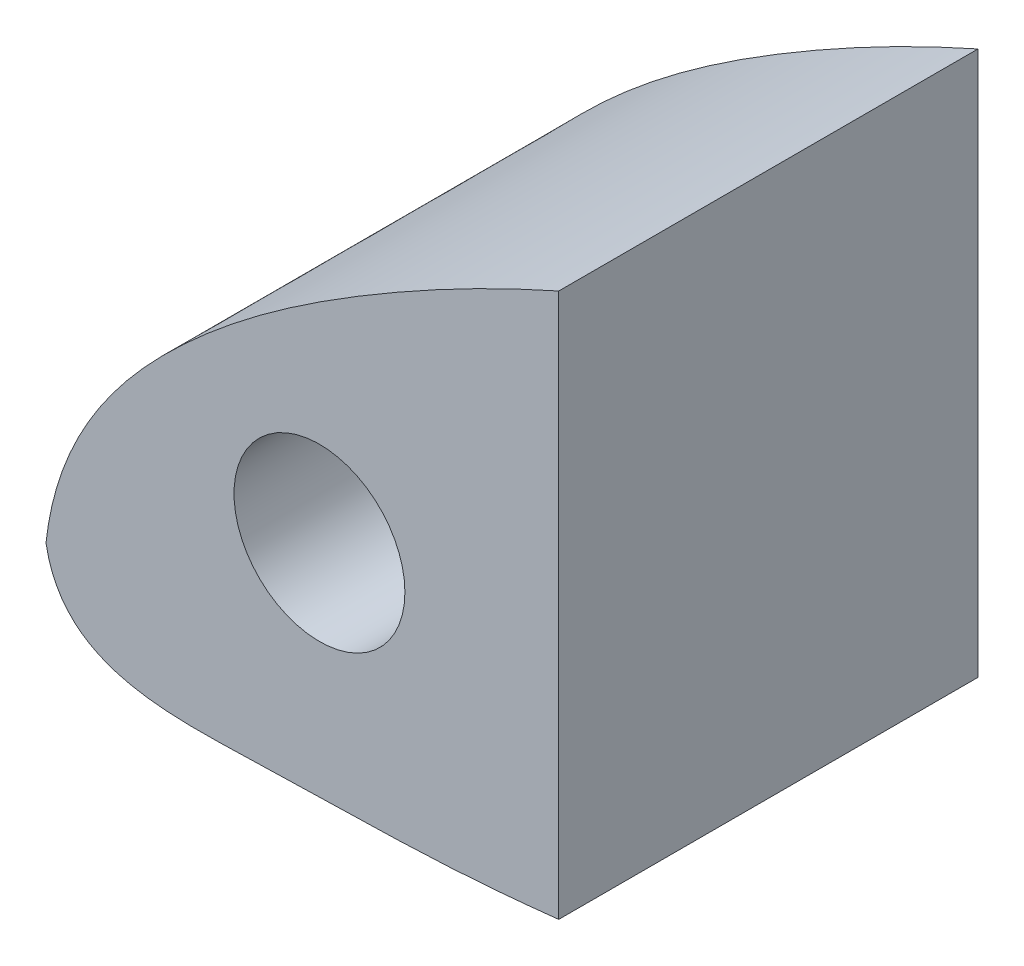
from build123d import *

# Parameters (mm, degrees)
BOSS_EXTRUDE1_DEPTH = 31.1531
SKETCH2_R           = 6.35
SKETCH2_R_2         = 3.175
CUT_EXTRUDE1_DEPTH  = 318.261218693
SKETCH3_W           = 293.188888759
SKETCH3_H           = 137.971241769
CUT_EXTRUDE2_DEPTH  = 318.261218693


with BuildPart() as part:
    # Sketch1 → Boss-Extrude1 (new body)
    with BuildSketch(Plane.XY):
        with BuildLine():
            add(Edge.make_bspline(
                [(0.000560351, 0.000130087), (0.810633127, 7.359196055), (8.649092025, 17.856605174), (26.286719818, 29.975176328), (52.111128271, 42.069215275), (89.597618475, 49.290763054), (131.400792109, 47.884831915), (173.256699242, 40.041104278), (217.961060472, 29.612974894), (256.952064401, 19.528920948), (290.35983767, 8.71099439), (301.273197721, 4.382828139), (314.816918223, -0.516206742), (309.846313895, 0.000130087)],
                knots=[0, 0, 0, 0, 0.060863618, 0.113688265, 0.188608742, 0.312908923, 0.448482434, 0.557612135, 0.691544113, 0.852438279, 0.92975597, 0.976058229, 1, 1, 1, 1], degree=3))
            add(Edge.make_bspline(
                [(309.846313895, 0.000130087), (303.956832565, 1.47095521), (293.989507544, 2.093987313), (276.26402299, 4.514356704), (260.846344817, 5.427413394), (235.858814759, 7.870306192), (205.101424636, 8.838080282), (157.718638092, 9.030650149), (110.497331172, 6.181495223), (66.506197185, -0.586669107), (36.454672816, -6.098499901), (15.316603331, -6.189065841), (1.230714189, -6.924076091), (0.000560351, 0.000130087)],
                knots=[0, 0, 0, 0, 0.057787081, 0.095274891, 0.171021118, 0.205339302, 0.335319146, 0.464904334, 0.658702312, 0.785511947, 0.893517288, 0.94309214, 1, 1, 1, 1], degree=3))
        make_face()
    extrude(amount=BOSS_EXTRUDE1_DEPTH)

    # Sketch2 → Cut-Extrude1 (cut, through all)
    with BuildSketch(Plane.XY.offset(31.1531)):
        with Locations((20.32, 10.16)):
            Circle(SKETCH2_R)
        with Locations((227.296313895, 19.050130087)):
            Circle(SKETCH2_R_2)
    extrude(amount=-CUT_EXTRUDE1_DEPTH, mode=Mode.SUBTRACT)

    # Sketch3 → Cut-Extrude2 (cut, through all)
    with BuildSketch(Plane.XY.offset(31.1531)):
        with Locations((184.69444438, 2.732377951)):
            Rectangle(SKETCH3_W, SKETCH3_H)
    extrude(amount=-CUT_EXTRUDE2_DEPTH, mode=Mode.SUBTRACT)


solid = part.part
